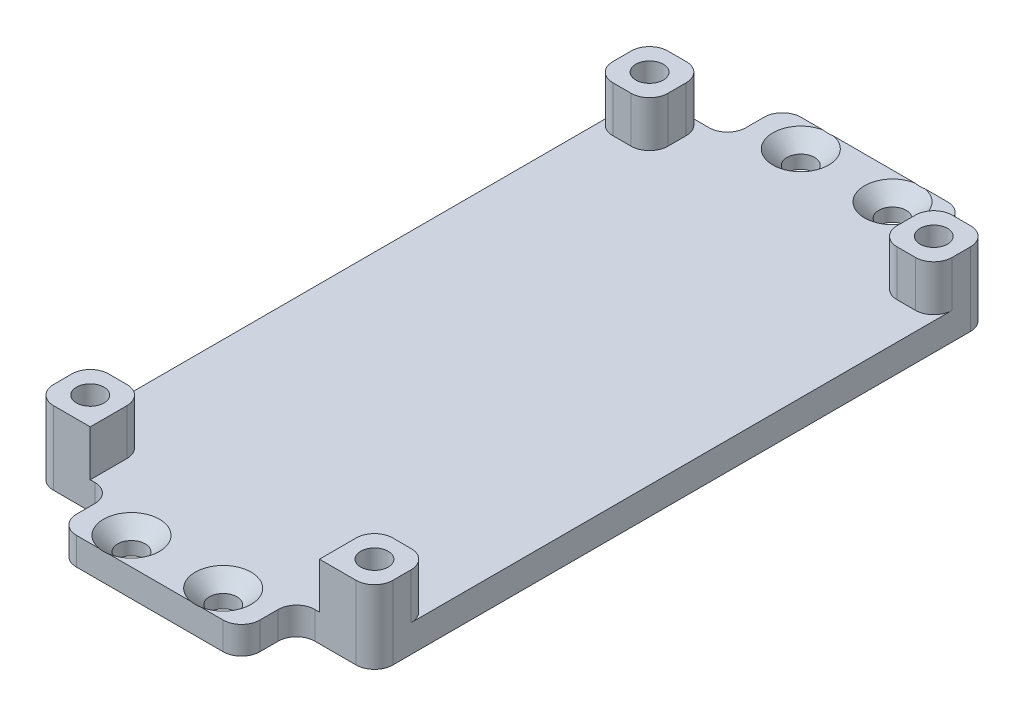
from build123d import *

# Parameters (mm, degrees)
SKETCH1_W           = 37
SKETCH1_H           = 67
SKETCH1_R           = 1.5
BOSS_EXTRUDE1_DEPTH = 3
SKETCH2_W           = 6
SKETCH2_H           = 6
SKETCH2_R           = 1.5
BOSS_EXTRUDE2_DEPTH = 5
FILLET1_R           = 2
SKETCH3_W           = 20
SKETCH3_H           = 6
SKETCH3_R           = 1.5
BOSS_EXTRUDE3_DEPTH = 3
FILLET2_R           = 2
CHAMFER1_SIZE       = 1.55


with BuildPart() as part:
    # Sketch1 → Boss-Extrude1 (new body)
    with BuildSketch(Plane(origin=(0, 0, 0), x_dir=(1, 0, 0), z_dir=(0, 1, 0))):
        with Locations((-18, 33)):
            Rectangle(SKETCH1_W, SKETCH1_H)
        with Locations(Location((-2.5, 63.5, 0), (0, 0, 270))):
            Circle(SKETCH1_R, mode=Mode.SUBTRACT)
        with Locations(Location((-33.5, 63.5, 0), (0, 0, 270))):
            Circle(SKETCH1_R, mode=Mode.SUBTRACT)
        with Locations(Location((-2.5, 2.5, 0), (0, 0, 270))):
            Circle(SKETCH1_R, mode=Mode.SUBTRACT)
        with Locations(Location((-33.5, 2.5, 0), (0, 0, 270))):
            Circle(SKETCH1_R, mode=Mode.SUBTRACT)
    extrude(amount=BOSS_EXTRUDE1_DEPTH)

    # Sketch2 → Boss-Extrude2 (add)
    # profile 1 of 4: a face of its own
    with BuildSketch(Plane(origin=(0, 3, 0), x_dir=(1, 0, 0), z_dir=(0, 1, 0))):
        with Locations((-33.5, 63.5)):
            Rectangle(SKETCH2_W, SKETCH2_H)
        with Locations(Location((-33.5, 63.5, 0), (0, 0, 270))):
            Circle(SKETCH2_R, mode=Mode.SUBTRACT)
    # profile 2 of 4: a face of its own
    with BuildSketch(Plane(origin=(0, 3, 0), x_dir=(1, 0, 0), z_dir=(0, 1, 0))):
        with Locations((-2.5, 63.5)):
            Rectangle(SKETCH2_W, SKETCH2_H)
        with Locations(Location((-2.5, 63.5, 0), (0, 0, 270))):
            Circle(SKETCH2_R, mode=Mode.SUBTRACT)
    # profile 3 of 4: a face of its own
    with BuildSketch(Plane(origin=(0, 3, 0), x_dir=(1, 0, 0), z_dir=(0, 1, 0))):
        with Locations((-2.5, 2.5)):
            Rectangle(SKETCH2_W, SKETCH2_H)
        with Locations(Location((-2.5, 2.5, 0), (0, 0, 270))):
            Circle(SKETCH2_R, mode=Mode.SUBTRACT)
    # profile 4 of 4: a face of its own
    with BuildSketch(Plane(origin=(0, 3, 0), x_dir=(1, 0, 0), z_dir=(0, 1, 0))):
        with Locations((-33.5, 2.5)):
            Rectangle(SKETCH2_W, SKETCH2_H)
        with Locations(Location((-33.5, 2.5, 0), (0, 0, 270))):
            Circle(SKETCH2_R, mode=Mode.SUBTRACT)
    extrude(amount=BOSS_EXTRUDE2_DEPTH)

    # Fillet1
    fillet1_edges = [part.edges().sort_by_distance(p)[0] for p in [
        (0.5, 4, 0.5),
        (-36.5, 4, 0.5),
        (-36.5, 4, -66.5),
        (0.5, 4, -66.5),
        (-36.5, 5.5, -60.5),
        (-30.5, 5.5, -60.5),
        (-30.5, 5.5, -66.5),
        (0.5, 5.5, -60.5),
        (-5.5, 5.5, -66.5),
        (-5.5, 5.5, -60.5),
        (0.5, 5.5, -5.5),
        (-5.5, 5.5, -5.5),
        (-36.5, 5.5, -5.5),
        (-30.5, 5.5, -5.5),
    ]]
    fillet(fillet1_edges, radius=FILLET1_R)

    # Sketch3 → Boss-Extrude3 (add)
    # profile 1 of 2: a face of its own
    with BuildSketch(Plane(origin=(0, 3, 0), x_dir=(1, 0, 0), z_dir=(0, 1, 0))):
        with Locations((-18, 69.5)):
            Rectangle(SKETCH3_W, SKETCH3_H)
        with Locations(Location((-13, 69.5, 0), (0, 0, 270))):
            Circle(SKETCH3_R, mode=Mode.SUBTRACT)
        with Locations(Location((-23, 69.5, 0), (0, 0, 270))):
            Circle(SKETCH3_R, mode=Mode.SUBTRACT)
    # profile 2 of 2: a face of its own
    with BuildSketch(Plane(origin=(0, 3, 0), x_dir=(1, 0, 0), z_dir=(0, 1, 0))):
        with Locations((-18, -3.5)):
            Rectangle(SKETCH3_W, SKETCH3_H)
        with Locations(Location((-23, -3.5, 0), (0, 0, 270))):
            Circle(SKETCH3_R, mode=Mode.SUBTRACT)
        with Locations(Location((-13, -3.5, 0), (0, 0, 270))):
            Circle(SKETCH3_R, mode=Mode.SUBTRACT)
    extrude(amount=-BOSS_EXTRUDE3_DEPTH)

    # Fillet2
    fillet2_edges = [part.edges().sort_by_distance(p)[0] for p in [
        (-28, 1.5, 0.5),
        (-8, 1.5, 0.5),
        (-8, 1.5, 6.5),
        (-28, 1.5, 6.5),
        (-28, 1.5, -66.5),
        (-8, 1.5, -66.5),
        (-8, 1.5, -72.5),
        (-28, 1.5, -72.5),
    ]]
    fillet(fillet2_edges, radius=FILLET2_R)

    # Chamfer1
    # the kernel refuses this chamfer: 1.55 mm, written as the material it takes off along each edge
    with BuildSketch(Plane(origin=(-23, 3, 3.5), x_dir=(0, 0, 1), z_dir=(-1, 0, 0))) as chamfer1_piece_1:
        Polygon((1.5 + CHAMFER1_SIZE, 0), (1.5, -CHAMFER1_SIZE), (1.5, 0), align=None)
    revolve(axis=Axis((-23, 3, 3.5), (0, 1, 0)), mode=Mode.SUBTRACT)
    with BuildSketch(Plane(origin=(-13, 3, 3.5), x_dir=(0, 0, 1), z_dir=(-1, 0, 0))) as chamfer1_piece_2:
        Polygon((1.5 + CHAMFER1_SIZE, 0), (1.5, -CHAMFER1_SIZE), (1.5, 0), align=None)
    revolve(axis=Axis((-13, 3, 3.5), (0, 1, 0)), mode=Mode.SUBTRACT)
    with BuildSketch(Plane(origin=(-23, 3, -69.5), x_dir=(0, 0, 1), z_dir=(-1, 0, 0))) as chamfer1_piece_3:
        Polygon((1.5 + CHAMFER1_SIZE, 0), (1.5, -CHAMFER1_SIZE), (1.5, 0), align=None)
    revolve(axis=Axis((-23, 3, -69.5), (0, 1, 0)), mode=Mode.SUBTRACT)
    with BuildSketch(Plane(origin=(-13, 3, -69.5), x_dir=(0, 0, 1), z_dir=(-1, 0, 0))) as chamfer1_piece_4:
        Polygon((1.5 + CHAMFER1_SIZE, 0), (1.5, -CHAMFER1_SIZE), (1.5, 0), align=None)
    revolve(axis=Axis((-13, 3, -69.5), (0, 1, 0)), mode=Mode.SUBTRACT)


solid = part.part
